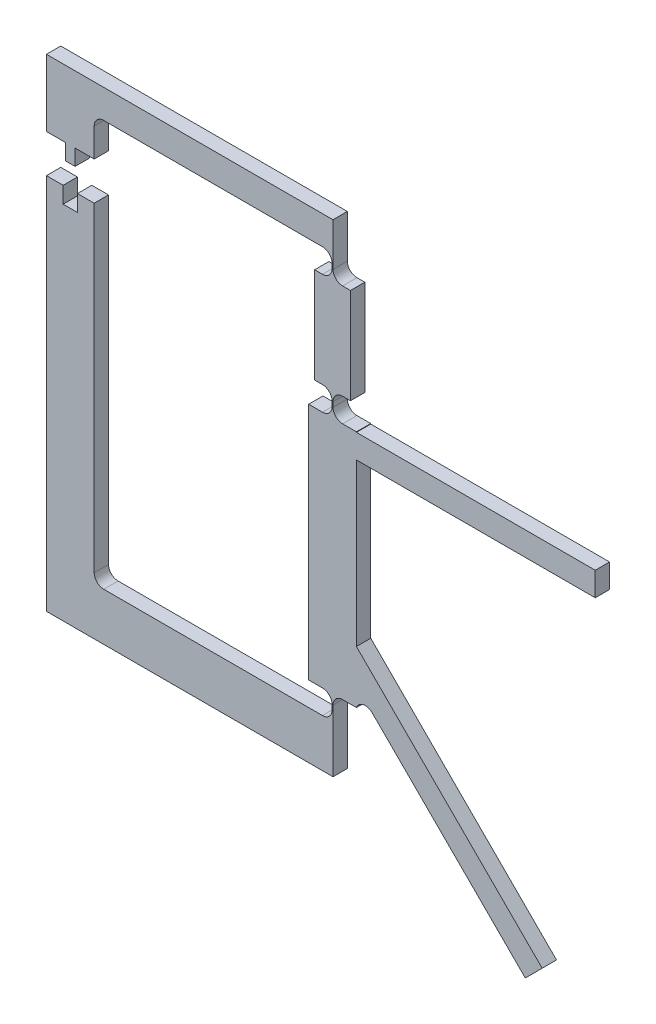
from build123d import *

# Parameters (mm, degrees)
BOSS_EXTRUDE1_DEPTH = 3
FILLET1_R           = 2


with BuildPart() as part:
    # Sketch2 → Boss-Extrude1 (new body)
    with BuildSketch(Plane.XY):
        Polygon((0, 0), (0, 79), (3.5, 79), (3.5, 75.566666667), (6.5, 75.566666667), (6.5, 79), (10, 79), (10, 10), (59.8, 10), (59.8, 15), (54.9, 15), (54.9, 65), (59.8, 65), (59.8, 70), (56.15, 70), (56.15, 90), (59.8, 90), (59.8, 95), (10, 95), (10, 87), (6, 87), (6, 83.666666667), (4, 83.666666667), (4, 87), (0, 87), (0, 91), (0, 101), (60, 101), (60, 95), (60, 90), (63.65, 90), (63.65, 70), (60, 70), (60, 65), (64.9, 65), (64.9, 64.9), (114.9, 64.9), (114.9, 59.9), (64.9, 59.9), (64.9, 26.071055471), (103.790928501, -12.819737276), (100.255400766, -16.355277353), (64.9, 19), (64.9, 15), (60, 15), (60, 10), (60, 0), align=None)
    extrude(amount=BOSS_EXTRUDE1_DEPTH)

    # Fillet1
    # the kernel refuses this fillet: 2 mm, written as the material it adds along each edge
    with BuildSketch(Plane(origin=(59.8, 15, 0), x_dir=(-1, 0, 0), z_dir=(0, 0, 1)), Plane(origin=(60, 15, 0), x_dir=(0, -1, 0), z_dir=(0, 0, 1)), Plane(origin=(60, 70, 0), x_dir=(0, -1, 0), z_dir=(0, 0, 1)), Plane(origin=(60, 65, 0), x_dir=(1, 0, 0), z_dir=(0, 0, 1)), Plane(origin=(59.8, 65, 0), x_dir=(0, 1, 0), z_dir=(0, 0, 1)), Plane(origin=(59.8, 70, 0), x_dir=(-1, 0, 0), z_dir=(0, 0, 1)), Plane(origin=(59.8, 95, 0), x_dir=(-1, 0, 0), z_dir=(0, 0, 1)), Plane(origin=(60, 90, 0), x_dir=(1, 0, 0), z_dir=(0, 0, 1)), Plane(origin=(59.8, 90, 0), x_dir=(0, 1, 0), z_dir=(0, 0, 1)), Plane(origin=(10, 10, 0), x_dir=(1, 0, 0), z_dir=(0, 0, 1)), Plane(origin=(10, 95, 0), x_dir=(0, -1, 0), z_dir=(0, 0, 1)), Plane(origin=(59.8, 10, 0), x_dir=(0, 1, 0), z_dir=(0, 0, 1))) as fillet1_piece_1:
        with BuildLine():
            CenterArc((FILLET1_R, FILLET1_R), FILLET1_R, 180, 90)
            Line((0, FILLET1_R), (-FILLET1_R * 0.02, FILLET1_R))
            Line((-FILLET1_R * 0.02, FILLET1_R), (-FILLET1_R * 0.02, -FILLET1_R * 0.02))
            Line((-FILLET1_R * 0.02, -FILLET1_R * 0.02), (FILLET1_R, -FILLET1_R * 0.02))
            Line((FILLET1_R, -FILLET1_R * 0.02), (FILLET1_R, 0))
        make_face()
    extrude(amount=3)
    with BuildSketch(Plane(origin=(64.9, 19, 0), x_dir=(0, -1, 0), z_dir=(0, 0, 1))) as fillet1_piece_2:
        with BuildLine():
            CenterArc((4.70139372, 1.87297807), FILLET1_R, 135.0001, 114.469955898)
            Line((3.287177689, 3.287189164), (3.258893369, 3.315473386))
            Line((3.258893369, 3.315473386), (-0.028284321, 0.028284222))
            Line((-0.028284321, 0.028284222), (0, -0.04))
            ThreePointArc((0, -0.04), (2, -0.04), (3.985972126, -0.037459561))
            Line((3.985972126, -0.037459561), (4, 0))
        make_face()
    extrude(amount=3)


solid = part.part
